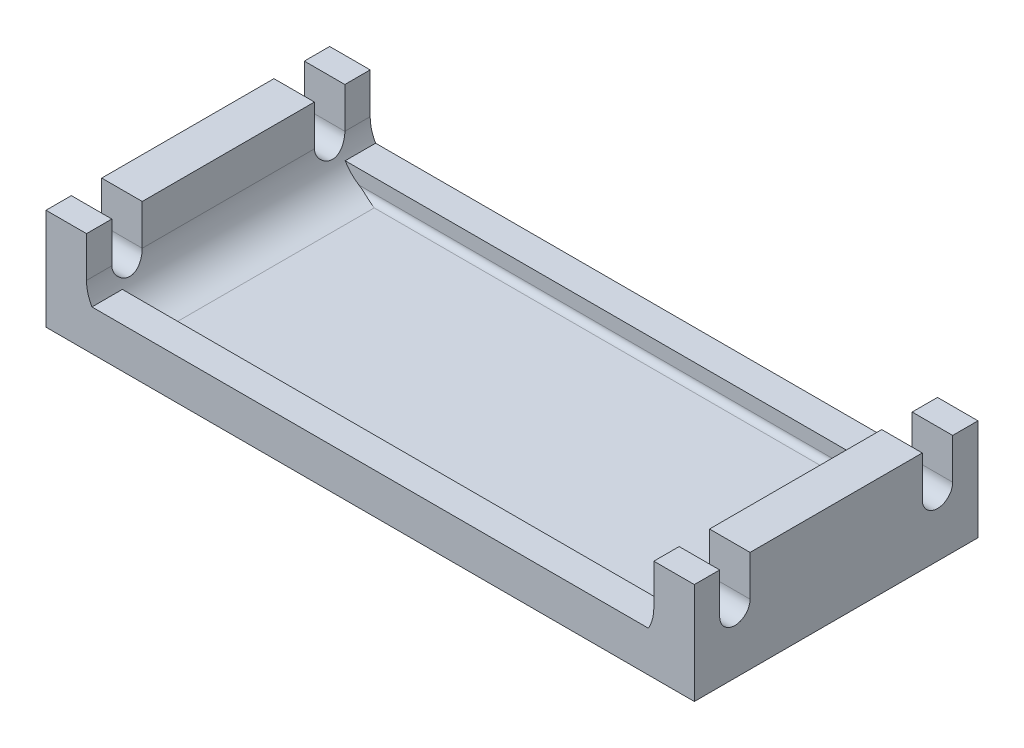
from build123d import *

# Parameters (mm, degrees)
SKETCH1_W           = 101.6
SKETCH1_H           = 44.45
BOSS_EXTRUDE1_DEPTH = 3.175
SKETCH2_W           = 6.35
SKETCH2_H           = 44.45
BOSS_EXTRUDE2_DEPTH = 12.7
SKETCH3_W           = 88.9
SKETCH3_H           = 4.7625
BOSS_EXTRUDE3_DEPTH = 3.175
FILLET1_R           = 0.9525
FILLET2_R           = 6.35
SKETCH4_R           = 2.38125
CUT_EXTRUDE1_DEPTH  = 106.20706371


with BuildPart() as part:
    # Sketch1 → Boss-Extrude1 (new body)
    with BuildSketch(Plane(origin=(0, 0, 0), x_dir=(1, 0, 0), z_dir=(0, 1, 0))):
        Rectangle(SKETCH1_W, SKETCH1_H)
    extrude(amount=BOSS_EXTRUDE1_DEPTH)

    # Sketch2 → Boss-Extrude2 (add)
    with BuildSketch(Plane(origin=(0, 3.175, 0), x_dir=(1, 0, 0), z_dir=(0, 1, 0))):
        with Locations((-47.625, 0)):
            Rectangle(SKETCH2_W, SKETCH2_H)
        with Locations((47.625, 0)):
            Rectangle(SKETCH2_W, SKETCH2_H)
    extrude(amount=BOSS_EXTRUDE2_DEPTH)

    # Sketch3 → Boss-Extrude3 (add)
    with BuildSketch(Plane(origin=(0, 3.175, 0), x_dir=(1, 0, 0), z_dir=(0, 1, 0))):
        with Locations((0, 19.84375)):
            Rectangle(SKETCH3_W, SKETCH3_H)
        with Locations((0, -19.84375)):
            Rectangle(SKETCH3_W, SKETCH3_H)
    extrude(amount=BOSS_EXTRUDE3_DEPTH)

    # Fillet1
    fillet1_edges = [part.edges().sort_by_distance(p)[0] for p in [
        (0, 3.175, 17.4625),
        (0, 3.175, -17.4625),
    ]]
    fillet(fillet1_edges, radius=FILLET1_R)

    # Fillet2
    # the kernel refuses this fillet: 6.35 mm, written as the material it adds along each edge
    with BuildSketch(Plane(origin=(44.45, 3.175, -32.385), x_dir=(0, 1, 0), z_dir=(0, 0, 1))) as fillet2_piece_1_section:
        with BuildLine():
            CenterArc((FILLET2_R, FILLET2_R), FILLET2_R, 180, 90)
            Line((0, FILLET2_R), (0, 0))
            Line((0, 0), (FILLET2_R, 0))
        make_face()
    fillet2_piece_1 = extrude(amount=64.77, mode=Mode.PRIVATE)
    fillet2_piece_1 = split(fillet2_piece_1, bisect_by=Plane(origin=(44.198002836, 7.13272394, -22.225), z_dir=(0, 0, 1)), keep=Keep.TOP, mode=Mode.PRIVATE)
    fillet2_piece_1 = split(fillet2_piece_1, bisect_by=Plane(origin=(44.198002836, 7.13272394, 22.225), z_dir=(0, 0, -1)), keep=Keep.TOP, mode=Mode.PRIVATE)
    add(fillet2_piece_1)
    with BuildSketch(Plane(origin=(-44.45, 3.175, -32.385), x_dir=(1, 0, 0), z_dir=(0, 0, 1))) as fillet2_piece_2_section:
        with BuildLine():
            CenterArc((FILLET2_R, FILLET2_R), FILLET2_R, 180, 90)
            Line((0, FILLET2_R), (0, 0))
            Line((0, 0), (FILLET2_R, 0))
        make_face()
    fillet2_piece_2 = extrude(amount=64.77, mode=Mode.PRIVATE)
    fillet2_piece_2 = split(fillet2_piece_2, bisect_by=Plane(origin=(-44.198002836, 7.13272394, -22.225), z_dir=(0, 0, 1)), keep=Keep.TOP, mode=Mode.PRIVATE)
    fillet2_piece_2 = split(fillet2_piece_2, bisect_by=Plane(origin=(-44.198002836, 7.13272394, 22.225), z_dir=(0, 0, -1)), keep=Keep.TOP, mode=Mode.PRIVATE)
    add(fillet2_piece_2)

    # Sketch4 → Cut-Extrude1 (cut, through all)
    with BuildSketch(Plane(origin=(50.8, 0, 0), x_dir=(0, 0, -1), z_dir=(1, 0, 0))):
        with BuildLine():
            Line((-18.25625, 15.875), (-18.25625, 9.525))
            ThreePointArc((-18.25625, 9.525), (-15.875, 11.90625), (-13.49375, 9.525))
            Line((-13.49375, 9.525), (-13.49375, 15.875))
            Line((-13.49375, 15.875), (-18.25625, 15.875))
        make_face()
        with Locations((-15.875, 9.525)):
            Circle(SKETCH4_R)
        with Locations((15.875, 9.525)):
            Circle(SKETCH4_R)
        with BuildLine():
            Line((18.25625, 15.875), (13.49375, 15.875))
            Line((13.49375, 15.875), (13.49375, 9.525))
            ThreePointArc((13.49375, 9.525), (15.875, 11.90625), (18.25625, 9.525))
            Line((18.25625, 9.525), (18.25625, 15.875))
        make_face()
    extrude(amount=-CUT_EXTRUDE1_DEPTH, mode=Mode.SUBTRACT)


solid = part.part
